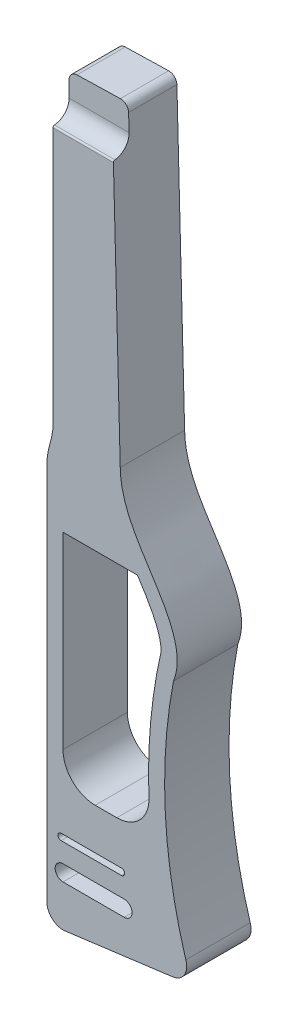
from build123d import *

# Parameters (mm, degrees)
BOSS_EXTRUDE3_DEPTH = 40
CUT_EXTRUDE1_START  = -10
CUT_EXTRUDE1_DEPTH  = 10
FILLET3_R           = 10
FILLET4_R           = 1
CUT_EXTRUDE3_DEPTH  = 634.823473561


with BuildPart() as part:
    # Sketch1 → Boss-Extrude3 (new body)
    with BuildSketch(Plane.XY):
        with BuildLine():
            Line((287.157860281, 534.451448831), (260.19721277, 533.779001198))
            ThreePointArc((260.19721277, 533.779001198), (256.742542962, 532.271733759), (255.321883101, 528.780555709))
            Line((255.321883101, 528.780555709), (255.321883101, 346.027702032))
            Line((255.321883101, 346.027702032), (255.321883101, 298.309919691))
            Line((255.321883101, 298.309919691), (298.321883101, 298.309919691))
            Line((298.321883101, 298.309919691), (297.107965759, 344.783089771))
            add(Edge.make_bspline(
                [(297.107965759, 344.783089771), (297.092597, 345.195665623), (297.081725868, 345.610516215), (297.075455466, 346.027702032)],
                knots=[0.989098045, 0.989098045, 0.989098045, 0.989098045, 1, 1, 1, 1], degree=3))
            Line((297.075455466, 346.027702032), (292.280825741, 529.583562912))
            ThreePointArc((292.280825741, 529.583562912), (290.726675353, 533.077622908), (287.157860281, 534.451448831))
        make_face()
        with BuildLine():
            Line((255.321883101, 298.309919691), (255.321883101, 346.027702032))
            add(Edge.make_bspline(
                [(255.321883101, 346.027702032), (254.757957002, 342.410351737), (253.98676421, 338.857518857), (253.008304725, 335.36920339)],
                knots=[0, 0, 0, 0, 0.135221531, 0.135221531, 0.135221531, 0.135221531], degree=3))
            ThreePointArc((253.008304725, 335.36920339), (251.895242603, 330.018633631), (251.521898803, 324.566283821))
            Line((251.521898803, 324.566283821), (251.521898803, 112.494253422))
            Line((251.521898803, 112.494253422), (251.521898803, 107.975148622))
            Line((251.521898803, 107.975148622), (251.521898803, 107.687415528))
            Line((251.521898803, 107.687415528), (251.521898803, 107.377085198))
            Line((251.521898803, 107.377085198), (251.521898803, 89.434656666))
            ThreePointArc((251.521898803, 89.434656666), (254.924316425, 81.919877444), (262.816280156, 79.518781671))
            Line((262.816280156, 79.518781671), (276.783936318, 81.342067431))
            Line((276.783936318, 81.342067431), (329.661316312, 88.244483474))
            ThreePointArc((329.661316312, 88.244483474), (336.875168963, 92.905840971), (337.812674038, 101.443346932))
            ThreePointArc((337.812674038, 101.443346932), (325.065095163, 174.067394927), (330.156614349, 247.625736037))
            add(Edge.make_bspline(
                [(330.156614349, 247.625736037), (336.006706917, 262.277420591), (320.933871266, 296.427871643), (297.92215095, 322.926208236), (297.107965759, 344.783089771)],
                knots=[0, 0, 0, 0, 0.411549101, 0.989098045, 0.989098045, 0.989098045, 0.989098045], degree=3))
            Line((297.107965759, 344.783089771), (298.321883101, 298.309919691))
            Line((298.321883101, 298.309919691), (255.321883101, 298.309919691))
        make_face()
    extrude(amount=BOSS_EXTRUDE3_DEPTH)

    # Sketch3 → Cut-Extrude1 (cut)
    with BuildSketch(Plane.XY.offset(40).offset(CUT_EXTRUDE1_START)):
        with BuildLine():
            Line((255.321883101, 508.869919691), (292.821883101, 508.869919691))
            Line((292.821883101, 508.869919691), (292.280825741, 529.583562912))
            ThreePointArc((292.280825741, 529.583562912), (290.726675353, 533.077622908), (287.157860281, 534.451448831))
            Line((287.157860281, 534.451448831), (260.19721277, 533.779001198))
            ThreePointArc((260.19721277, 533.779001198), (256.742542962, 532.271733759), (255.321883101, 528.780555709))
            Line((255.321883101, 528.780555709), (255.321883101, 508.869919691))
        make_face()
        with BuildLine():
            Line((260.321883101, 126.869919691), (297.821883101, 126.869919691))
            ThreePointArc((297.821883101, 126.869919691), (299.821883101, 128.869919691), (297.821883101, 130.869919691))
            Line((297.821883101, 130.869919691), (260.321883101, 130.869919691))
            ThreePointArc((260.321883101, 130.869919691), (258.321883101, 128.869919691), (260.321883101, 126.869919691))
        make_face()
    extrude(amount=CUT_EXTRUDE1_DEPTH, mode=Mode.SUBTRACT)

    # Fillet3
    fillet3_edges = [part.edges().sort_by_distance(p)[0] for p in [
        (274.071883101, 508.869919691, 30),
    ]]
    fillet(fillet3_edges, radius=FILLET3_R - 0.0001)  # a hair under: the kernel refuses the full size

    # Fillet4
    fillet4_edges = [part.edges().sort_by_distance(p)[0] for p in [
        (274.071883101, 508.869919691, 40),
    ]]
    fillet(fillet4_edges, radius=FILLET4_R)

    # Sketch7 → Cut-Extrude3 (cut, through all)
    with BuildSketch(Plane.XY):
        with BuildLine():
            Line((261.521898803, 105.235423074), (299.520758285, 105.235423074))
            ThreePointArc((299.520758285, 105.235423074), (304.415246799, 110.129911588), (299.520758285, 115.024400103))
            Line((299.520758285, 115.024400103), (261.521898803, 115.024400103))
            ThreePointArc((261.521898803, 115.024400103), (256.627410288, 110.129911588), (261.521898803, 105.235423074))
        make_face()
        with BuildLine():
            Line((307.783918876, 293.411121556), (261.521898803, 293.411121556))
            Line((261.521898803, 293.411121556), (261.521898803, 176.49325551))
            ThreePointArc((261.521898803, 176.49325551), (267.379763179, 162.351119886), (281.521898803, 156.49325551))
            Line((281.521898803, 156.49325551), (294.92087878, 156.49325551))
            ThreePointArc((294.92087878, 156.49325551), (309.345533596, 162.639399244), (314.90458823, 177.300322166))
            ThreePointArc((314.90458823, 177.300322166), (315.963249783, 218.705128996), (322.4563298, 259.611347408))
            add(Edge.make_bspline(
                [(322.4563298, 259.611347408), (322.456016347, 259.894497294), (322.421435552, 261.716157514), (321.977489562, 265.178835066), (320.516125801, 270.243060555), (318.282615138, 275.554318374), (315.425430629, 281.021812849), (312.162343995, 286.528772314), (309.555661166, 290.650913462), (308.084642597, 292.943229146), (307.783918876, 293.411121556)],
                knots=[0.113442682, 0.113442682, 0.113442682, 0.113442682, 0.125, 0.1875, 0.25, 0.3125, 0.375, 0.4375, 0.498593555, 0.514218555, 0.514218555, 0.514218555, 0.514218555], degree=3))
        make_face()
    extrude(amount=CUT_EXTRUDE3_DEPTH, mode=Mode.SUBTRACT)


solid = part.part
